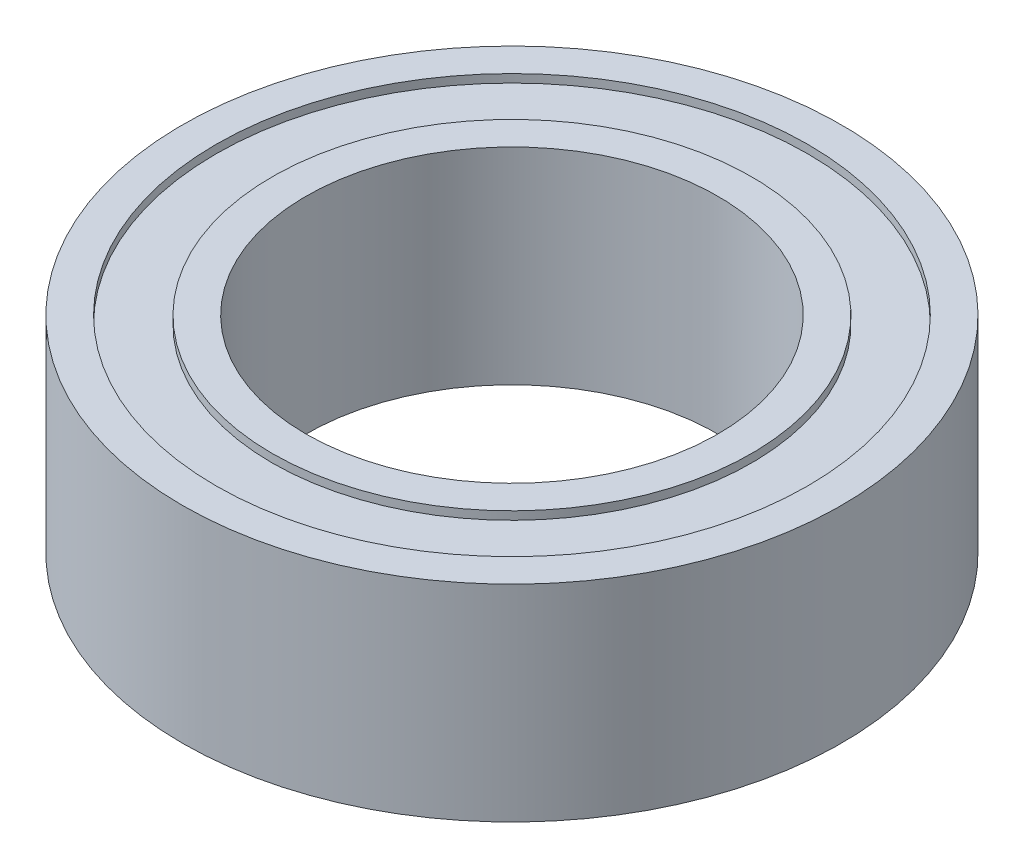
from build123d import *

# Parameters (mm, degrees)
SKETCH1_R           = 4
SKETCH1_R_2         = 2.5
BOSS_EXTRUDE1_DEPTH = 1.25
SKETCH2_R           = 3.590807055
SKETCH2_R_2         = 2.909192945
CUT_EXTRUDE1_DEPTH  = 0.1


with BuildPart() as part:
    # Sketch1 → Boss-Extrude1 (new body)
    with BuildSketch(Plane(origin=(0, 0, 0), x_dir=(1, 0, 0), z_dir=(0, 1, 0))):
        Circle(SKETCH1_R)
        Circle(SKETCH1_R_2, mode=Mode.SUBTRACT)
    extrude(amount=BOSS_EXTRUDE1_DEPTH)

    # Sketch2 → Cut-Extrude1 (cut)
    with BuildSketch(Plane(origin=(0, 1.25, 0), x_dir=(1, 0, 0), z_dir=(0, 1, 0))):
        Circle(SKETCH2_R)
        Circle(SKETCH2_R_2, mode=Mode.SUBTRACT)
    extrude(amount=-CUT_EXTRUDE1_DEPTH, mode=Mode.SUBTRACT)

    # Mirror1: part across plane


with BuildPart() as part_1:
    add(part.part)
    add(part.part.mirror(Plane.ZX))


solid = part_1.part
